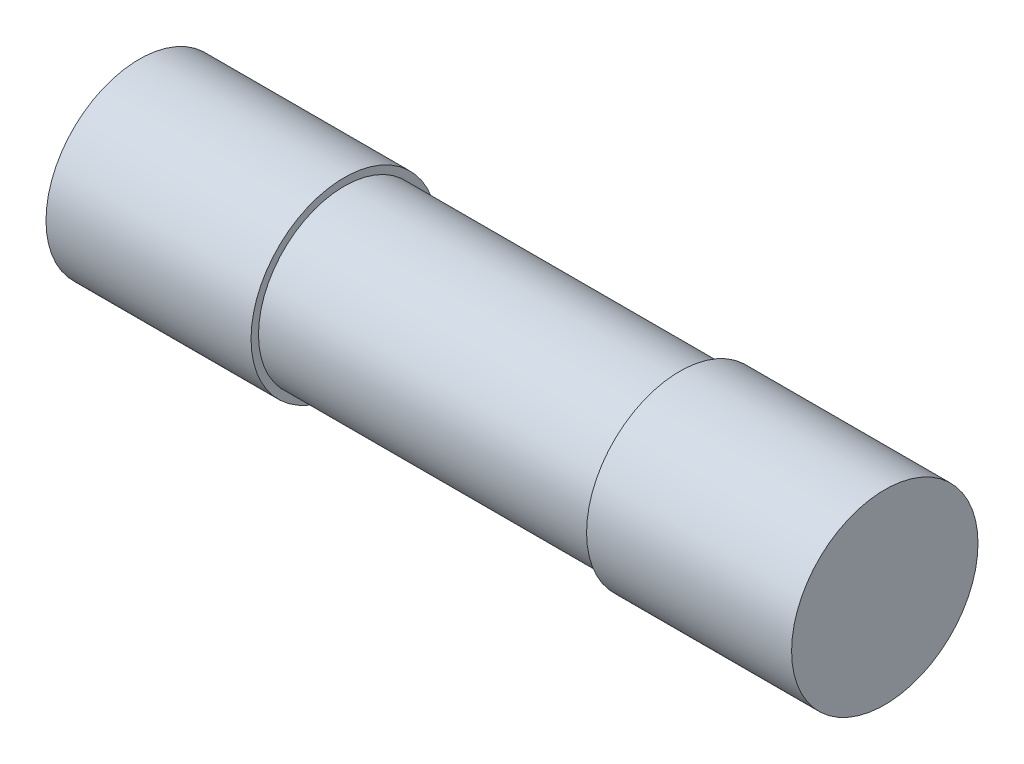
from build123d import *

# Parameters (mm, degrees)
CUT_EXTRUDE1_START  = -14.5
SKETCH2_R           = 2.5
SKETCH2_R_2         = 2.3
CUT_EXTRUDE1_DEPTH  = 9
BOSS_EXTRUDE2_REACH = 21.818
SKETCH3_R           = 0.15


# Read off the part's stored shape, not the designer's step: Extrude-Thin1
with BuildPart() as part:
    # Extrude-Thin1 outline → Extrude-Thin1 (revolve)
    with BuildSketch(Plane.YX):
        Polygon((2.5, 20), (0, 20), (0, 19.5), (1.5, 19.5), (1.5, 0.5), (0, 0.5), (0, 0), (2.5, 0), align=None)
    revolve(axis=Axis((0, 0, 0), (1, 0, 0)))

    # Sketch2 → Cut-Extrude1 (cut)
    with BuildSketch(Plane.ZY.offset(CUT_EXTRUDE1_START)):
        Circle(SKETCH2_R)
        Circle(SKETCH2_R_2, mode=Mode.SUBTRACT)
    extrude(amount=CUT_EXTRUDE1_DEPTH, mode=Mode.SUBTRACT)

    # Sketch3 → Boss-Extrude2 (add, up to next)
    with BuildSketch(Plane(origin=(0.5, 0, 0), x_dir=(0, 0, -1), z_dir=(1, 0, 0)), mode=Mode.PRIVATE) as boss_extrude2_sk1:
        Circle(SKETCH3_R)
    boss_extrude2_tool1 = extrude(boss_extrude2_sk1.sketch, amount=BOSS_EXTRUDE2_REACH, mode=Mode.PRIVATE) - part.part
    add(boss_extrude2_tool1.solids().sort_by_distance((0.5, 0, 0))[0])


solid = part.part
